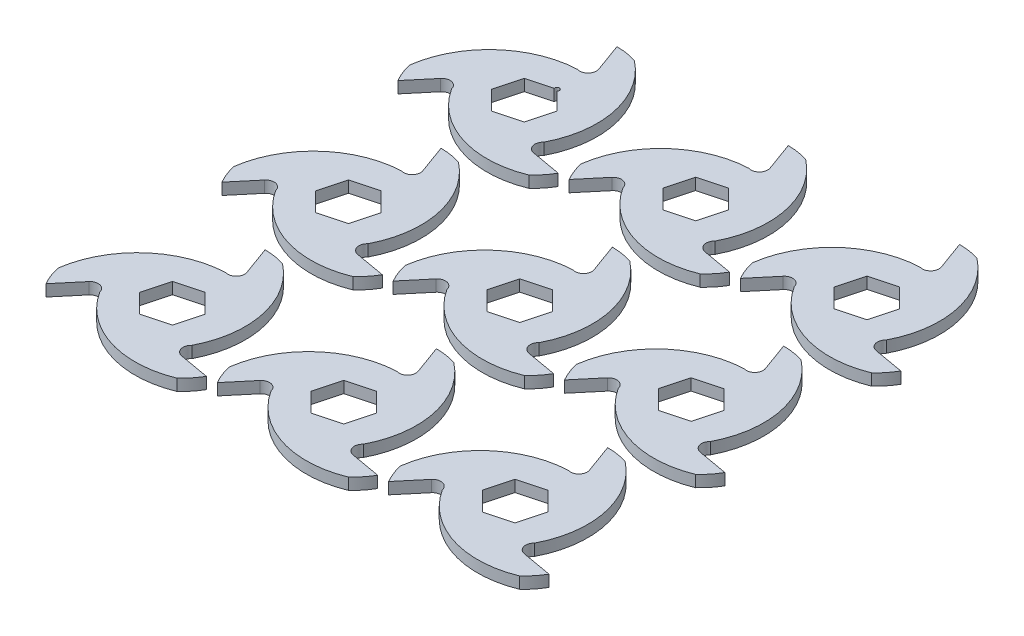
from build123d import *

# Parameters (mm, degrees)
BOSS_EXTRUDE2_DEPTH = 3.175
CUT_EXTRUDE1_DEPTH  = 71.887102156
LPATTERN1_COUNT     = 3
LPATTERN1_PITCH     = 96.52
LPATTERN1_2_COUNT   = 3
LPATTERN1_2_PITCH   = 93.98
SKETCH4_R           = 1.27
CUT_EXTRUDE2_DEPTH  = 328.532303151


with BuildPart() as part:
    # Sketch2 → Boss-Extrude2 (new, symmetric)
    with BuildSketch(Plane(origin=(0, 0, 0), x_dir=(1, 0, 0), z_dir=(0, 1, 0))):
        with BuildLine():
            Line((0, 50.8), (5.699182497, 35.141624781))
            ThreePointArc((5.699182497, 35.141624781), (4.697625818, 30.400196659), (0, 29.21))
            ThreePointArc((0, 29.21), (-40.712457699, 16.982230342), (-43.994090512, -25.4))
            Line((-43.994090512, -25.4), (-33.283131039, -12.635175567))
            ThreePointArc((-33.283131039, -12.635175567), (-28.676155496, -11.131835033), (-25.296602045, -14.605))
            ThreePointArc((-25.296602045, -14.605), (5.64918596, -43.749137789), (43.994090512, -25.4))
            Line((43.994090512, -25.4), (27.583948542, -22.506449213))
            ThreePointArc((27.583948542, -22.506449213), (23.978529677, -19.268361626), (25.296602045, -14.605))
            ThreePointArc((25.296602045, -14.605), (35.063271738, 26.766907447), (0, 50.8))
        make_face()
        Polygon((14.16500941, 3.795502832), (10.369506578, -10.369506578), (-3.795502832, -14.16500941), (-14.16500941, -3.795502832), (-10.369506578, 10.369506578), (3.795502832, 14.16500941), align=None, mode=Mode.SUBTRACT)
    extrude(amount=BOSS_EXTRUDE2_DEPTH, both=True)

    # Sketch3 → Cut-Extrude1 (cut, through all)
    with BuildSketch(Plane(origin=(0, 3.175, 0), x_dir=(1, 0, 0), z_dir=(0, 1, 0))):
        with BuildLine():
            ThreePointArc((-25.296602045, -14.605), (0.069562989, -42.437673587), (36.840744267, -34.314849269))
            ThreePointArc((36.840744267, -34.314849269), (2.193682996, -35.741164715), (-25.296602045, -14.605))
        make_face()
        with BuildLine():
            ThreePointArc((11.297159061, 49.062445064), (29.855915106, 19.77036756), (25.296602045, -14.605))
            ThreePointArc((25.296602045, -14.605), (36.717321909, 21.279080109), (11.297159061, 49.062445064))
        make_face()
        with BuildLine():
            ThreePointArc((0, 29.21), (-36.786884898, 21.158593478), (-48.137903328, -14.747595795))
            ThreePointArc((-48.137903328, -14.747595795), (-32.049598102, 15.970797155), (0, 29.21))
        make_face()
    extrude(amount=-CUT_EXTRUDE1_DEPTH, mode=Mode.SUBTRACT)


with BuildPart() as lpattern1_1:
    # LPattern1: pattern copy
    add(part.part.moved(Location(Vector(0, 0, 1) * (1 * LPATTERN1_PITCH))))


with BuildPart() as lpattern1_2:
    # LPattern1: pattern copy
    add(part.part.moved(Location(Vector(0, 0, 1) * (2 * LPATTERN1_PITCH))))


with BuildPart() as lpattern1_2_1:
    # LPattern1 2: pattern copy
    add(part.part.moved(Location(Vector(1, 0, 0) * (1 * LPATTERN1_2_PITCH))))


with BuildPart() as lpattern1_2_2:
    # LPattern1 2: pattern copy
    add(part.part.moved(Location(Vector(1, 0, 0) * (2 * LPATTERN1_2_PITCH))))


with BuildPart() as lpattern1_2_3:
    # LPattern1 2: pattern copy
    add(lpattern1_1.part.moved(Location(Vector(1, 0, 0) * (1 * LPATTERN1_2_PITCH))))


with BuildPart() as lpattern1_2_4:
    # LPattern1 2: pattern copy
    add(lpattern1_1.part.moved(Location(Vector(1, 0, 0) * (2 * LPATTERN1_2_PITCH))))


with BuildPart() as lpattern1_2_5:
    # LPattern1 2: pattern copy
    add(lpattern1_2.part.moved(Location(Vector(1, 0, 0) * (1 * LPATTERN1_2_PITCH))))


with BuildPart() as lpattern1_2_6:
    # LPattern1 2: pattern copy
    add(lpattern1_2.part.moved(Location(Vector(1, 0, 0) * (2 * LPATTERN1_2_PITCH))))


with BuildPart() as part_1:
    add(part.part)

    # Sketch4 → Cut-Extrude2 (cut, through all)
    with BuildSketch(Plane(origin=(0, 3.175, 0), x_dir=(1, 0, 0), z_dir=(0, 1, 0))):
        with Locations((3.795502832, 14.16500941)):
            Circle(SKETCH4_R)
    extrude(amount=-CUT_EXTRUDE2_DEPTH, mode=Mode.SUBTRACT)


solid = Compound([lpattern1_1.part, lpattern1_2.part, lpattern1_2_1.part, lpattern1_2_2.part, lpattern1_2_3.part, lpattern1_2_4.part, lpattern1_2_5.part, lpattern1_2_6.part, part_1.part])
